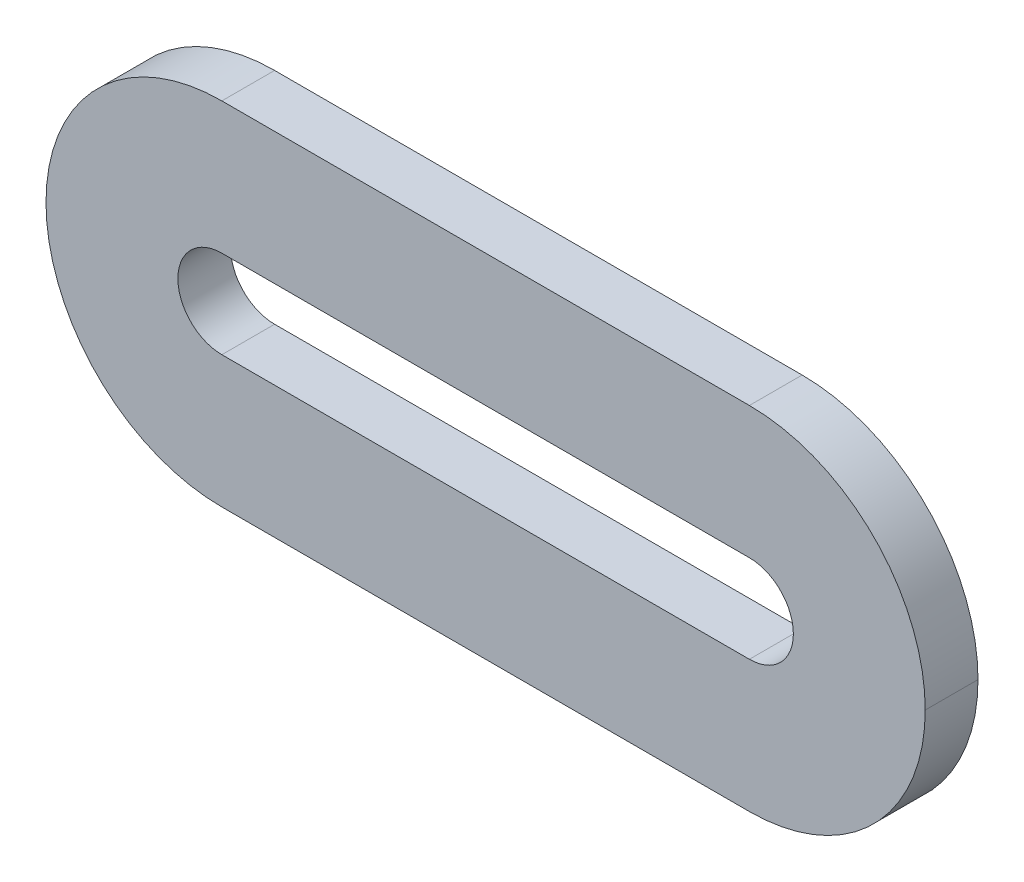
from build123d import *

# Parameters (mm, degrees)
SKETCH2_W           = 50
SKETCH2_H           = 20
BOSS_EXTRUDE1_DEPTH = 3
FILLET1_R           = 10


with BuildPart() as part:
    # Sketch2 → Boss-Extrude1 (new body)
    with BuildSketch(Plane.XY):
        Rectangle(SKETCH2_W, SKETCH2_H)
        with BuildLine():
            Line((-15, 2.5), (15, 2.5))
            ThreePointArc((15, 2.5), (17.5, 0), (15, -2.5))
            Line((15, -2.5), (-15, -2.5))
            ThreePointArc((-15, -2.5), (-17.5, 0), (-15, 2.5))
        make_face(mode=Mode.SUBTRACT)
    extrude(amount=BOSS_EXTRUDE1_DEPTH)

    # Fillet1
    fillet1_edges = [part.edges().sort_by_distance(p)[0] for p in [
        (25, -10, 1.5),
        (-25, -10, 1.5),
        (-25, 10, 1.5),
        (25, 10, 1.5),
    ]]
    fillet(fillet1_edges, radius=FILLET1_R - 0.0001)  # a hair under: the kernel refuses the full size


solid = part.part
